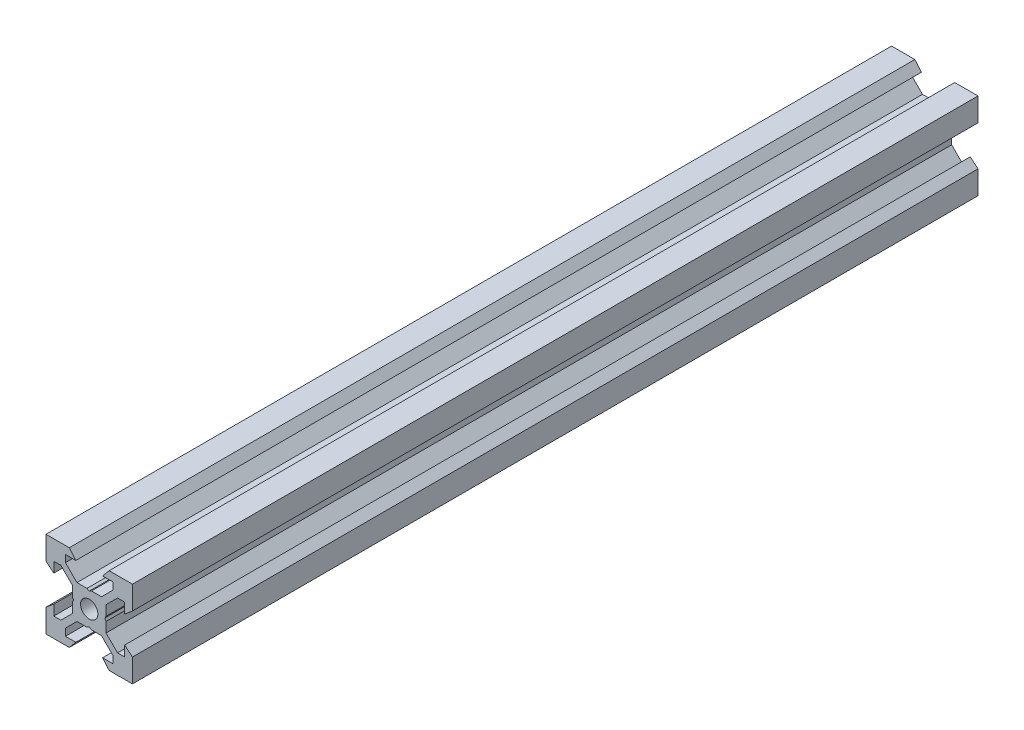
from build123d import *

# Parameters (mm, degrees)
SKETCH1_R           = 2
BOSS_EXTRUDE1_DEPTH = 97.845


with BuildPart() as part:
    # Sketch1 → Boss-Extrude1 (new, symmetric)
    with BuildSketch(Plane.XY):
        Polygon((10, 4.610379336), (10, 10), (4.610379336, 10), (3.1, 8.2), (5.5, 8.2), (5.5, 6.560660172), (2.839339828, 3.9), (0.519615242, 3.9), (0, 3.6), (-0.519615242, 3.9), (-2.839339828, 3.9), (-5.5, 6.560660172), (-5.5, 8.2), (-3.1, 8.2), (-4.610379336, 10), (-10, 10), (-10, 4.610379336), (-8.2, 3.1), (-8.2, 5.5), (-6.560660172, 5.5), (-3.9, 2.839339828), (-3.9, 0.519615242), (-3.6, 0), (-3.9, -0.519615242), (-3.9, -2.839339828), (-6.560660172, -5.5), (-8.2, -5.5), (-8.2, -3.1), (-10, -4.610379336), (-10, -10), (-4.610379336, -10), (-3.1, -8.2), (-5.5, -8.2), (-5.5, -6.560660172), (-2.839339828, -3.9), (-0.519615242, -3.9), (0, -3.6), (0.519615242, -3.9), (2.839339828, -3.9), (5.5, -6.560660172), (5.5, -8.2), (3.1, -8.2), (4.610379336, -10), (10, -10), (10, -4.610379336), (8.2, -3.1), (8.2, -5.5), (6.560660172, -5.5), (3.9, -2.839339828), (3.9, -0.519615242), (3.6, 0), (3.9, 0.519615242), (3.9, 2.839339828), (6.560660172, 5.5), (8.2, 5.5), (8.2, 3.1), align=None)
        Circle(SKETCH1_R, mode=Mode.SUBTRACT)
    extrude(amount=BOSS_EXTRUDE1_DEPTH, both=True)


solid = part.part
